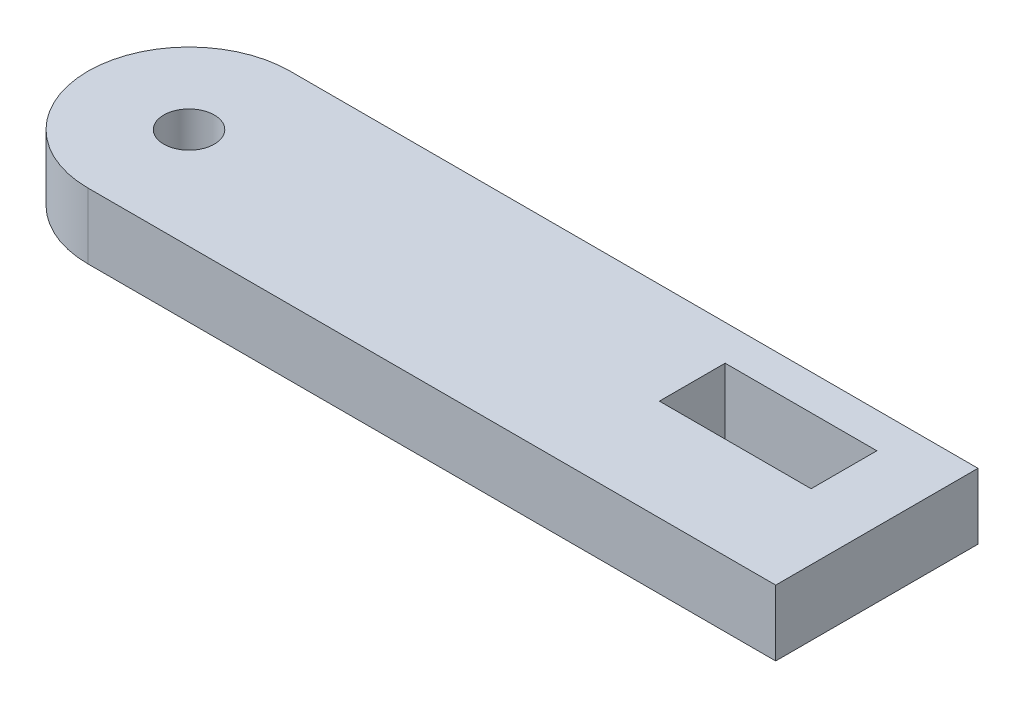
from build123d import *

# Parameters (mm, degrees)
SKETCH1_W           = 78
SKETCH1_H           = 20
BOSS_EXTRUDE1_DEPTH = 6.5
SKETCH2_R           = 2.5
CUT_EXTRUDE1_DEPTH  = 81.785209042
SKETCH3_W           = 15
SKETCH3_H           = 6.5
CUT_EXTRUDE2_DEPTH  = 81.785209042
FILLET1_R           = 10


with BuildPart() as part:
    # Sketch1 → Boss-Extrude1 (new body)
    with BuildSketch(Plane(origin=(0, 0, 0), x_dir=(1, 0, 0), z_dir=(0, 1, 0))):
        with Locations((39, 10)):
            Rectangle(SKETCH1_W, SKETCH1_H)
    extrude(amount=BOSS_EXTRUDE1_DEPTH)

    # Sketch2 → Cut-Extrude1 (cut, through all)
    with BuildSketch(Plane(origin=(0, 6.5, 0), x_dir=(1, 0, 0), z_dir=(0, 1, 0))):
        with Locations(Location((10, 10, 0), (0, 0, 270))):
            Circle(SKETCH2_R)
    extrude(amount=-CUT_EXTRUDE1_DEPTH, mode=Mode.SUBTRACT)

    # Sketch3 → Cut-Extrude2 (cut, through all)
    with BuildSketch(Plane(origin=(0, 6.5, 0), x_dir=(1, 0, 0), z_dir=(0, 1, 0))):
        with Locations((64, 13.25)):
            Rectangle(SKETCH3_W, SKETCH3_H)
    extrude(amount=-CUT_EXTRUDE2_DEPTH, mode=Mode.SUBTRACT)

    # Fillet1
    fillet1_edges = [part.edges().sort_by_distance(p)[0] for p in [
        (0, 3.25, 0),
        (0, 3.25, -20),
    ]]
    fillet(fillet1_edges, radius=FILLET1_R - 0.0001)  # a hair under: the kernel refuses the full size


solid = part.part
